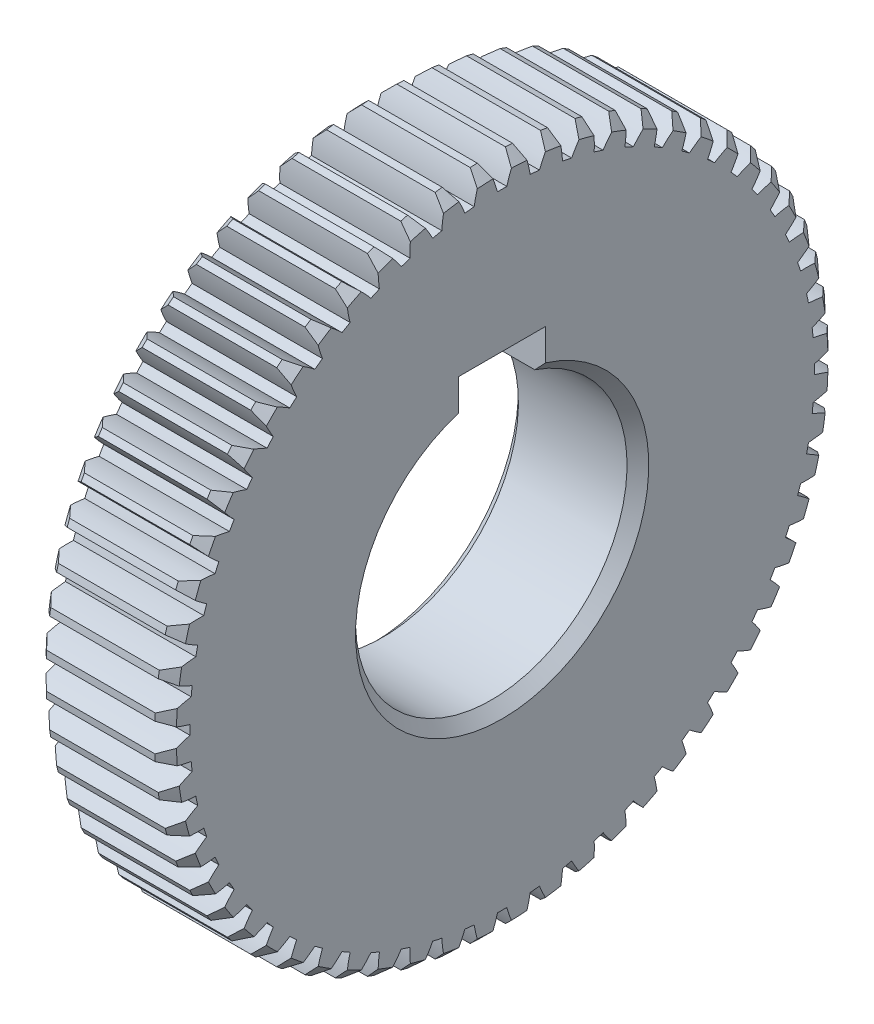
from build123d import *

# Parameters (mm, degrees)
BASPROSKE_W     = 12
BASPROSKE_H     = 31
TOOTHCUT_DEPTH  = 46.453272709
TEETHCUTS_COUNT = 60
TEETHCUTS_ANGLE = 354
BORSKE_R        = 12.5
BORE_DEPTH      = 50.0000508
KEYSKE_W        = 8
KEYSKE_H        = 15.8
KEYWAY_DEPTH    = 50.0000508
CHAMFER1_SIZE   = 1


with BuildPart() as part:
    # BasProSke → Base-Revolve (revolve)
    with BuildSketch(Plane(origin=(0, 0, 0), x_dir=(1, 0, 0), z_dir=(0, 1, 0))):
        with Locations((6, 15.5)):
            Rectangle(BASPROSKE_W, BASPROSKE_H)
    revolve(axis=Axis((-10, 0, 0), (1, 0, 0)))

    # TooCutSke → ToothCut (cut, through all)
    with BuildSketch(Plane(origin=(0, 0, 0), x_dir=(0, 0, -1), z_dir=(1, 0, 0))):
        with BuildLine():
            ThreePointArc((0.430151971, 28.745781782), (0, 28.749), (-0.430151971, 28.745781782))
            ThreePointArc((-0.430151971, 28.745781782), (-0.81454129, 29.893990802), (-1.312684569, 30.997617721))
            ThreePointArc((-1.312684569, 30.997617721), (0, 31.0254), (1.312684569, 30.997617721))
            ThreePointArc((1.312684569, 30.997617721), (0.81454129, 29.893990802), (0.430151971, 28.745781782))
        make_face()
    toothcut = extrude(amount=TOOTHCUT_DEPTH, mode=Mode.SUBTRACT)

    # TeethCuts: ToothCut ×60 about axis
    teethcuts_axis = Axis((-10, 0, 0), (1, 0, 0))
    for i in range(1, TEETHCUTS_COUNT):
        add(toothcut.rotate(teethcuts_axis, i * TEETHCUTS_ANGLE / (TEETHCUTS_COUNT - 1)), mode=Mode.SUBTRACT)

    # BorSke → Bore (cut, symmetric)
    with BuildSketch(Plane(origin=(0, 0, 0), x_dir=(0, 0, -1), z_dir=(1, 0, 0))):
        Circle(BORSKE_R)
    extrude(amount=BORE_DEPTH, both=True, mode=Mode.SUBTRACT)

    # KeySke → Keyway (cut, symmetric)
    with BuildSketch(Plane(origin=(0, 0, 0), x_dir=(0, 0, -1), z_dir=(1, 0, 0))):
        with Locations((0, 7.9)):
            Rectangle(KEYSKE_W, KEYSKE_H)
    extrude(amount=KEYWAY_DEPTH, both=True, mode=Mode.SUBTRACT)

    # Chamfer1
    chamfer1_edges = [part.edges().sort_by_distance(p)[0] for p in [
        (12, -12.5, 0),
        (12, -27.62120225, 14.073705492),
        (12, -28.940993221, 11.109406436),
        (12, -29.943700615, 8.023390398),
        (12, -30.618338558, 4.849468416),
        (12, -30.957515577, 1.622414644),
        (12, -28.940993221, -11.109406436),
        (12, -30.957515577, -1.622414644),
        (12, -30.618338558, -4.849468416),
        (12, -29.943700615, -8.023390398),
        (12, -27.62120225, -14.073705492),
        (12, -25.998787606, -16.883810085),
        (12, -24.091524805, -19.508932123),
        (12, -21.920310217, -21.920310217),
        (12, -19.508932123, -24.091524805),
        (12, -16.883810085, -25.998787606),
        (12, -14.073705492, -27.62120225),
        (12, -11.109406436, -28.940993221),
        (12, -8.023390398, -29.943700615),
        (12, -4.849468416, -30.618338558),
        (12, -1.622414644, -30.957515577),
        (12, 1.622414644, -30.957515577),
        (12, 4.849468416, -30.618338558),
        (12, 8.023390398, -29.943700615),
        (12, 11.109406436, -28.940993221),
        (12, 14.073705492, -27.62120225),
        (12, 16.883810085, -25.998787606),
        (12, 19.508932123, -24.091524805),
        (12, 21.920310217, -21.920310217),
        (12, 24.091524805, -19.508932123),
        (12, 25.998787606, -16.883810085),
        (12, 27.62120225, -14.073705492),
        (12, 28.940993221, -11.109406436),
        (12, 29.943700615, -8.023390398),
        (12, 30.618338558, -4.849468416),
        (12, 30.957515577, -1.622414644),
        (12, 30.957515577, 1.622414644),
        (12, 30.618338558, 4.849468416),
        (12, 29.943700615, 8.023390398),
        (12, 28.940993221, 11.109406436),
        (12, 27.62120225, 14.073705492),
        (12, 25.998787606, 16.883810085),
        (12, 24.091524805, 19.508932123),
        (12, 21.920310217, 21.920310217),
        (12, 19.508932123, 24.091524805),
        (12, 16.883810085, 25.998787606),
        (12, 14.073705492, 27.62120225),
        (12, 11.109406436, 28.940993221),
        (12, 8.023390398, 29.943700615),
        (12, 4.849468416, 30.618338558),
        (12, 1.622414644, 30.957515577),
        (12, -25.998787606, 16.883810085),
        (12, -24.091524805, 19.508932123),
        (12, -21.920310217, 21.920310217),
        (12, -19.508932123, 24.091524805),
        (12, -16.883810085, 25.998787606),
        (12, -1.622414644, 30.957515577),
        (12, -4.849468416, 30.618338558),
        (12, -8.023390398, 29.943700615),
        (12, -14.073705492, 27.62120225),
        (12, -11.109406436, 28.940993221),
        (0, 28.940993221, 11.109406436),
        (0, 29.943700615, 8.023390398),
        (0, 30.618338558, 4.849468416),
        (0, 30.957515577, 1.622414644),
        (0, 27.62120225, 14.073705492),
        (0, 25.998787606, 16.883810085),
        (0, 24.091524805, 19.508932123),
        (0, 21.920310217, 21.920310217),
        (0, 19.508932123, 24.091524805),
        (0, 16.883810085, 25.998787606),
        (0, 14.073705492, 27.62120225),
        (0, 11.109406436, 28.940993221),
        (0, 8.023390398, 29.943700615),
        (0, 4.849468416, 30.618338558),
        (0, 1.622414644, 30.957515577),
        (0, -1.622414644, 30.957515577),
        (0, -4.849468416, 30.618338558),
        (0, -8.023390398, 29.943700615),
        (0, -11.109406436, 28.940993221),
        (0, -14.073705492, 27.62120225),
        (0, -16.883810085, 25.998787606),
        (0, -19.508932123, 24.091524805),
        (0, -21.920310217, 21.920310217),
        (0, -24.091524805, 19.508932123),
        (0, -25.998787606, 16.883810085),
        (0, -27.62120225, 14.073705492),
        (0, -28.940993221, 11.109406436),
        (0, -29.943700615, 8.023390398),
        (0, -30.618338558, 4.849468416),
        (0, -30.957515577, 1.622414644),
        (0, -30.957515577, -1.622414644),
        (0, -30.618338558, -4.849468416),
        (0, -29.943700615, -8.023390398),
        (0, -28.940993221, -11.109406436),
        (0, -27.62120225, -14.073705492),
        (0, -25.998787606, -16.883810085),
        (0, -24.091524805, -19.508932123),
        (0, -21.920310217, -21.920310217),
        (0, -19.508932123, -24.091524805),
        (0, -16.883810085, -25.998787606),
        (0, -14.073705492, -27.62120225),
        (0, -11.109406436, -28.940993221),
        (0, -8.023390398, -29.943700615),
        (0, -4.849468416, -30.618338558),
        (0, -1.622414644, -30.957515577),
        (0, 1.622414644, -30.957515577),
        (0, 4.849468416, -30.618338558),
        (0, 8.023390398, -29.943700615),
        (0, 11.109406436, -28.940993221),
        (0, 14.073705492, -27.62120225),
        (0, 16.883810085, -25.998787606),
        (0, 19.508932123, -24.091524805),
        (0, 21.920310217, -21.920310217),
        (0, 24.091524805, -19.508932123),
        (0, 25.998787606, -16.883810085),
        (0, 27.62120225, -14.073705492),
        (0, 28.940993221, -11.109406436),
        (0, 29.943700615, -8.023390398),
        (0, 30.618338558, -4.849468416),
        (0, 30.957515577, -1.622414644),
        (0, -12.5, 0),
    ]]
    chamfer(chamfer1_edges, length=CHAMFER1_SIZE)


solid = part.part
